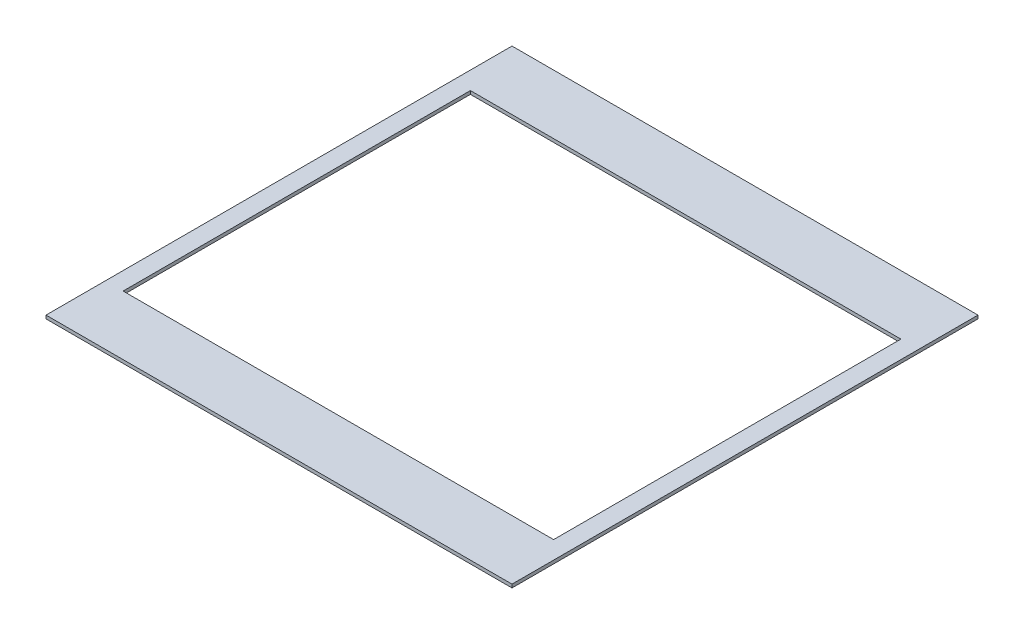
from build123d import *

# Parameters (mm, degrees)
SKETCH1_W           = 420
SKETCH1_H           = 420
SKETCH1_W_2         = 388
SKETCH1_H_2         = 313
BOSS_EXTRUDE1_DEPTH = 3


with BuildPart() as part:
    # Sketch1 → Boss-Extrude1 (new body)
    with BuildSketch(Plane(origin=(0, 0, 0), x_dir=(1, 0, 0), z_dir=(0, 1, 0))):
        Rectangle(SKETCH1_W, SKETCH1_H)
        Rectangle(SKETCH1_W_2, SKETCH1_H_2, mode=Mode.SUBTRACT)
    extrude(amount=BOSS_EXTRUDE1_DEPTH)


solid = part.part
